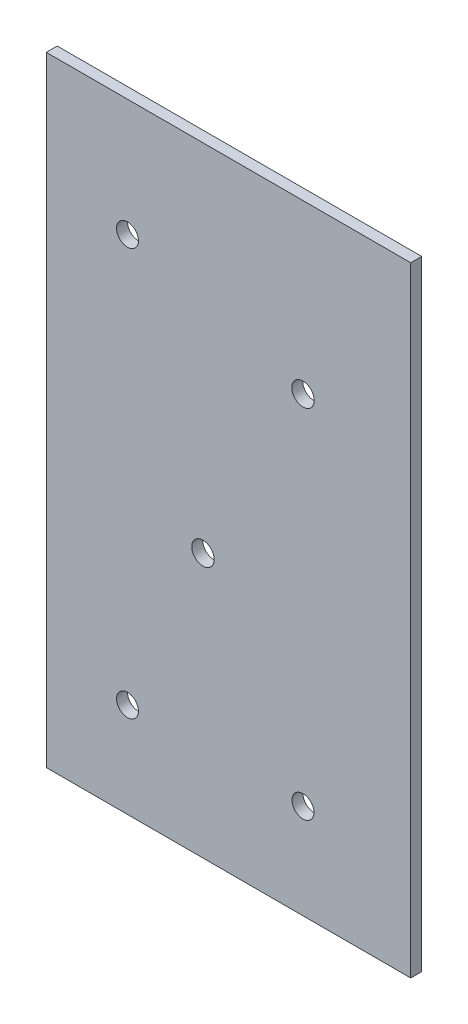
from build123d import *

# Parameters (mm, degrees)
SKETCH1_W           = 105.497827183
SKETCH1_H           = 179.29887024
SKETCH1_R           = 3.175
SKETCH1_R_2         = 3.2512
BOSS_EXTRUDE1_DEPTH = 3.175


with BuildPart() as part:
    # Sketch1 → Boss-Extrude1 (new body)
    with BuildSketch(Plane.XY):
        with Locations((54.6380005, 121.166691813)):
            Rectangle(SKETCH1_W, SKETCH1_H)
        with Locations((25.4, 58.964285714)):
            Circle(SKETCH1_R, mode=Mode.SUBTRACT)
        with Locations((76.2, 58.964285714)):
            Circle(SKETCH1_R, mode=Mode.SUBTRACT)
        with Locations((25.4, 176.892857143)):
            Circle(SKETCH1_R, mode=Mode.SUBTRACT)
        with Locations((76.2, 162.306)):
            Circle(SKETCH1_R_2, mode=Mode.SUBTRACT)
        with Locations((47.244, 107.95)):
            Circle(SKETCH1_R_2, mode=Mode.SUBTRACT)
    extrude(amount=BOSS_EXTRUDE1_DEPTH)


solid = part.part
